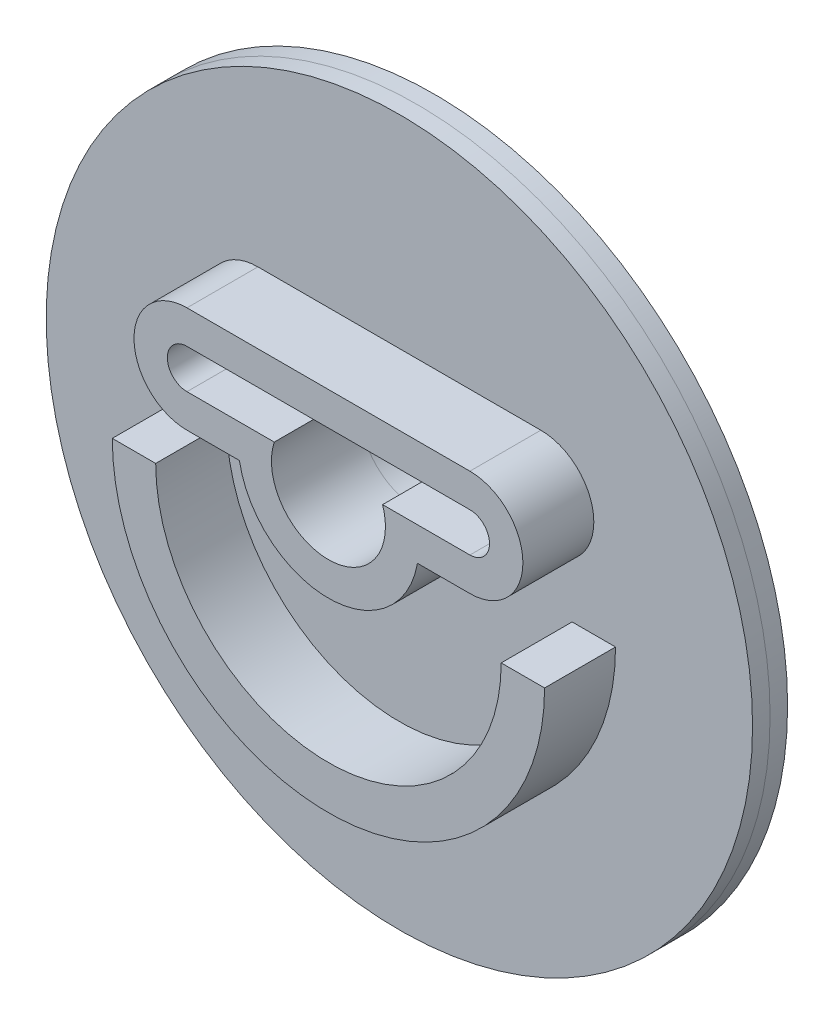
from build123d import *
from build123d.topology import SkipClean

# Parameters (mm, degrees)
SKETCH1_R               = 21.16
BOSS_EXTRUDE2_DEPTH     = 2.1
CUT_EXTRUDE1_DEPTH      = 30.998353288
CUT_EXTRUDE1_DEPTH_BACK = 30.998353288
SKETCH3_R               = 3.415
BOSS_EXTRUDE3_START     = 4.25
BOSS_EXTRUDE3_DEPTH     = 4.25
BOSS_EXTRUDE4_DEPTH     = 4.25
SKETCH6_R               = 4.85
SKETCH6_R_2             = 3.415
BOSS_EXTRUDE5_DEPTH     = 1.48
SKETCH7_R               = 11.25
SKETCH7_R_2             = 10
BOSS_EXTRUDE6_DEPTH     = 6
SPLIT1_SURFACE_1_BACK   = 62.11
SPLIT1_SURFACE_1_DEPTH  = 124.22
SPLIT1_SURFACE_2_BACK   = 62.11
SPLIT1_SURFACE_2_DEPTH  = 124.22


with BuildPart() as part:
    # Sketch1 → Boss-Extrude2 (new body)
    with BuildSketch(Plane.XY):
        Circle(SKETCH1_R)
    extrude(amount=BOSS_EXTRUDE2_DEPTH)

    # Sketch3 → Cut-Extrude1 (cut, two sides: drawn at the far end of the back side and taken through both)
    with BuildSketch(Plane.XY.offset(2.1).offset(-CUT_EXTRUDE1_DEPTH_BACK)):
        with Locations((0, 3.595)):
            Circle(SKETCH3_R)
    extrude(amount=CUT_EXTRUDE1_DEPTH + CUT_EXTRUDE1_DEPTH_BACK, mode=Mode.SUBTRACT)

    # Sketch4 → Boss-Extrude3 (add)
    with BuildSketch(Plane.XY.offset(2.1).offset(BOSS_EXTRUDE3_START)):
        with BuildLine():
            Line((-8.475, 9.01), (8.475, 9.01))
            ThreePointArc((8.475, 9.01), (11.65, 5.835), (8.475, 2.66))
            Line((8.475, 2.66), (5.333666656, 2.66))
            ThreePointArc((5.333666656, 2.66), (0, -1.82), (-5.333666656, 2.66))
            Line((-5.333666656, 2.66), (-8.475, 2.66))
            ThreePointArc((-8.475, 2.66), (-11.65, 5.835), (-8.475, 9.01))
        make_face()
        with BuildLine():
            Line((-8.475, 7.01), (8.475, 7.01))
            ThreePointArc((8.475, 7.01), (9.65, 5.835), (8.475, 4.66))
            Line((8.475, 4.66), (3.244687967, 4.66))
            ThreePointArc((3.244687967, 4.66), (0, 0.18), (-3.244687967, 4.66))
            Line((-3.244687967, 4.66), (-8.475, 4.66))
            ThreePointArc((-8.475, 4.66), (-9.65, 5.835), (-8.475, 7.01))
        make_face(mode=Mode.SUBTRACT)
    extrude(amount=-BOSS_EXTRUDE3_DEPTH)

    # Sketch5 → Boss-Extrude4 (add)
    with BuildSketch(Plane.XY.offset(2.1)):
        with BuildLine():
            Line((10.35, 0), (12.95, 0))
            ThreePointArc((12.95, 0), (0, -12.95), (-12.95, 0))
            Line((-12.95, 0), (-10.35, 0))
            ThreePointArc((-10.35, 0), (0, -10.35), (10.35, 0))
        make_face()
    extrude(amount=BOSS_EXTRUDE4_DEPTH)

    # Sketch6 → Boss-Extrude5 (add)
    with SkipClean():  # the faces are left unmerged after this step: merging them gives an invalid solid
        with BuildSketch(Plane(origin=(0, 0, 0), x_dir=(-1, 0, 0), z_dir=(0, 0, -1))):
            with Locations((0, 3.595)):
                Circle(SKETCH6_R)
            with Locations((0, 3.595)):
                Circle(SKETCH6_R_2, mode=Mode.SUBTRACT)
        extrude(amount=BOSS_EXTRUDE5_DEPTH)

    # Sketch7 → Boss-Extrude6 (add)
    with SkipClean():  # the faces are left unmerged after this step: merging them gives an invalid solid
        with BuildSketch(Plane(origin=(0, 0, 0), x_dir=(-1, 0, 0), z_dir=(0, 0, -1))):
            Circle(SKETCH7_R)
            Circle(SKETCH7_R_2, mode=Mode.SUBTRACT)
        extrude(amount=BOSS_EXTRUDE6_DEPTH)


with BuildPart() as body_2:
    # Split1: the piece behind the surface
    add(part.part)
    # Split1 surface: a surface, the sketch's curves swept straight by 124.22 mm
    with BuildLine(Plane(origin=(0, 0, 0), x_dir=(0, 0, -1), z_dir=(1, 0, 0)).offset(-SPLIT1_SURFACE_1_BACK), mode=Mode.PRIVATE) as split1_surface_1_path:
        Line((-1.05, 21.16), (-1.05, -21.16))
    split1_surface_1 = Shell.extrude(split1_surface_1_path.wire(), (1 * SPLIT1_SURFACE_1_DEPTH, 0 * SPLIT1_SURFACE_1_DEPTH, 0 * SPLIT1_SURFACE_1_DEPTH))
    split(bisect_by=split1_surface_1, keep=Keep.BOTTOM)


with BuildPart() as part_1:
    add(part.part)

    # Split1: split by a surface, the side it looks to stays
    # Split1 surface: a surface, the sketch's curves swept straight by 124.22 mm
    with BuildLine(Plane(origin=(0, 0, 0), x_dir=(0, 0, -1), z_dir=(1, 0, 0)).offset(-SPLIT1_SURFACE_2_BACK), mode=Mode.PRIVATE) as split1_surface_2_path:
        Line((-1.05, 21.16), (-1.05, -21.16))
    split1_surface_2 = Shell.extrude(split1_surface_2_path.wire(), (1 * SPLIT1_SURFACE_2_DEPTH, 0 * SPLIT1_SURFACE_2_DEPTH, 0 * SPLIT1_SURFACE_2_DEPTH))
    split(bisect_by=split1_surface_2, keep=Keep.TOP)


solid = Compound([body_2.part, part_1.part])
